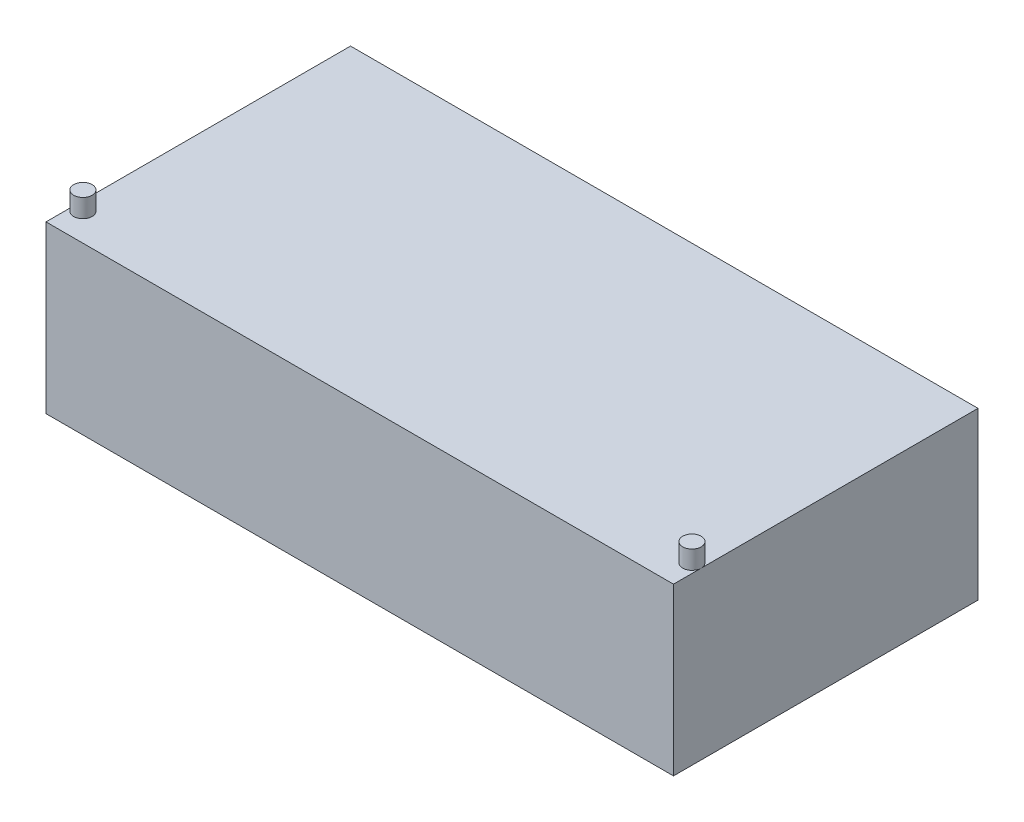
from build123d import *

# Parameters (mm, degrees)
SKETCH1_W           = 340
SKETCH1_H           = 165
BOSS_EXTRUDE1_DEPTH = 90
SKETCH2_R           = 5
BOSS_EXTRUDE2_DEPTH = 10


with BuildPart() as part:
    # Sketch1 → Boss-Extrude1 (new body)
    with BuildSketch(Plane(origin=(0, 0, 0), x_dir=(1, 0, 0), z_dir=(0, 1, 0))):
        Rectangle(SKETCH1_W, SKETCH1_H)
    extrude(amount=BOSS_EXTRUDE1_DEPTH)

    # Sketch2 → Boss-Extrude2 (add)
    with BuildSketch(Plane(origin=(0, 90, 0), x_dir=(1, 0, 0), z_dir=(0, 1, 0))):
        with Locations((-165, -67.5)):
            Circle(SKETCH2_R)
        with Locations((165, -67.5)):
            Circle(SKETCH2_R)
    extrude(amount=BOSS_EXTRUDE2_DEPTH)


solid = part.part
